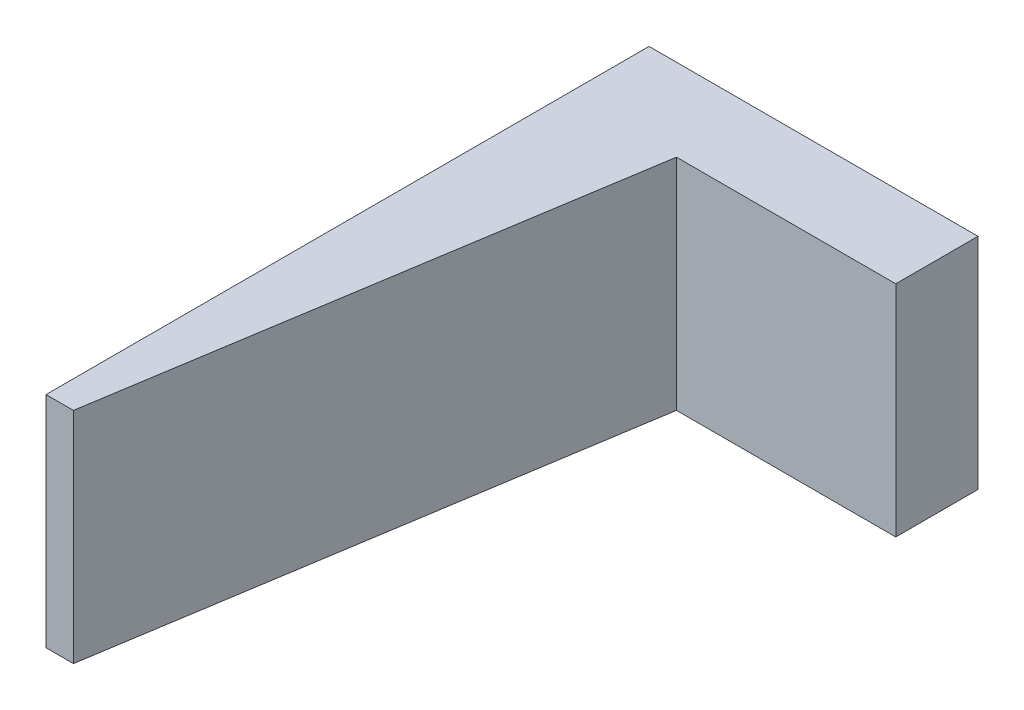
from build123d import *

# Parameters (mm, degrees)
BOSS_EXTRUDE1_DEPTH = 25.4


with BuildPart() as part:
    # Sketch1 → Boss-Extrude1 (new body)
    with BuildSketch(Plane(origin=(0, 0, 0), x_dir=(1, 0, 0), z_dir=(0, 1, 0))):
        Polygon((0, 0), (38.1, 0), (38.1, -9.525), (12.7, -9.525), (3.175, -69.85), (0, -69.85), align=None)
    extrude(amount=BOSS_EXTRUDE1_DEPTH)


solid = part.part
